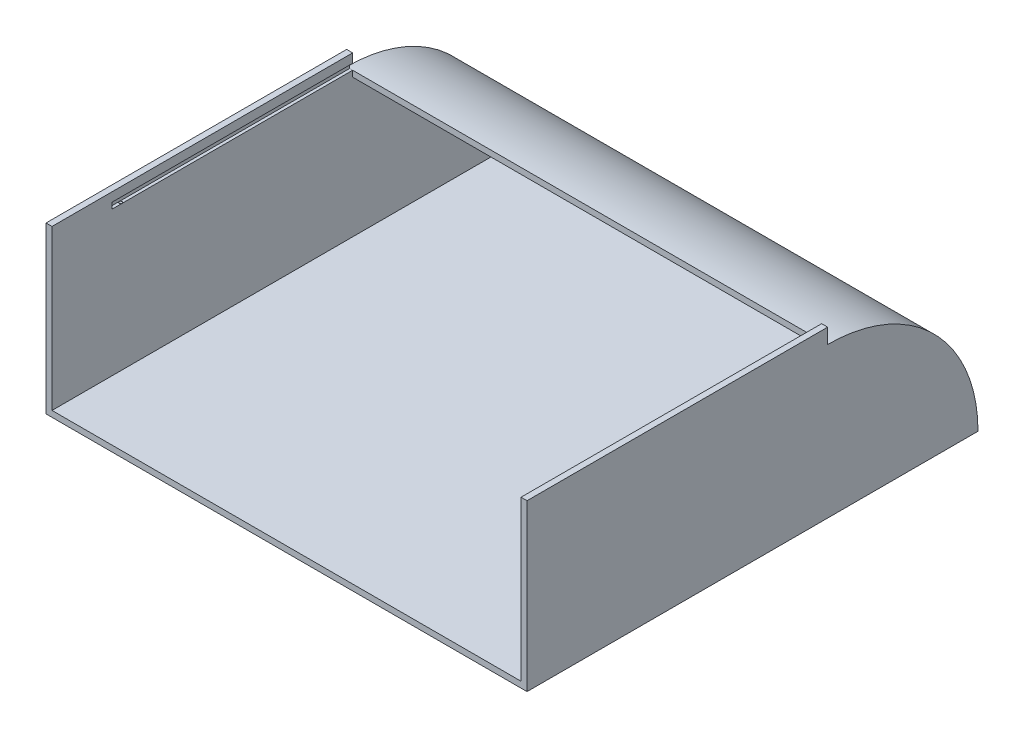
from build123d import *

# Parameters (mm, degrees)
SKETCH1_W           = 150
SKETCH1_H           = 50
BOSS_EXTRUDE1_DEPTH = 160
FILLET2_R           = 50
SHELL1_T            = -2
CUT_EXTRUDE1_DEPTH  = 2
SKETCH20_W          = 2
SKETCH20_H          = 100
BOSS_EXTRUDE2_DEPTH = 5
SKETCH21_W          = 80
SKETCH21_H          = 2
CUT_EXTRUDE2_DEPTH  = 1
SKETCH22_W          = 80
SKETCH22_H          = 2
CUT_EXTRUDE3_DEPTH  = 1


with BuildPart() as part:
    # Sketch1 → Boss-Extrude1 (new body)
    with BuildSketch(Plane(origin=(0, 0, 0), x_dir=(0, 0, -1), z_dir=(1, 0, 0))):
        Rectangle(SKETCH1_W, SKETCH1_H)
    extrude(amount=-BOSS_EXTRUDE1_DEPTH)

    # Fillet2
    fillet2_edges = [part.edges().sort_by_distance(p)[0] for p in [
        (-80, 25, -75),
    ]]
    fillet(fillet2_edges, radius=FILLET2_R - 0.0001)  # a hair under: the kernel refuses the full size

    # Shell1
    shell1_openings = [part.faces().sort_by_distance(p)[0] for p in [
        (-80, 0, 75),
    ]]
    offset(amount=SHELL1_T, openings=shell1_openings, kind=Kind.INTERSECTION)

    # Sketch17 → Cut-Extrude1 (cut)
    with BuildSketch(Plane(origin=(0, 25, 0), x_dir=(1, 0, 0), z_dir=(0, 1, 0))):
        Polygon((-80, 25), (-158, 25), (-158, -75), (-2, -75), (-2, 25), align=None)
    extrude(amount=-CUT_EXTRUDE1_DEPTH, mode=Mode.SUBTRACT)

    # Sketch20 → Boss-Extrude2 (add)
    with BuildSketch(Plane(origin=(0, 25, 0), x_dir=(1, 0, 0), z_dir=(0, 1, 0))):
        with Locations((-159, -25)):
            Rectangle(SKETCH20_W, SKETCH20_H)
        with Locations((-1, -25)):
            Rectangle(SKETCH20_W, SKETCH20_H)
    extrude(amount=BOSS_EXTRUDE2_DEPTH)

    # Sketch21 → Cut-Extrude2 (cut)
    with BuildSketch(Plane(origin=(-158, 0, 0), x_dir=(0, 0, -1), z_dir=(1, 0, 0))):
        with Locations((-15, 26)):
            Rectangle(SKETCH21_W, SKETCH21_H)
    extrude(amount=-CUT_EXTRUDE2_DEPTH, mode=Mode.SUBTRACT)

    # Sketch22 → Cut-Extrude3 (cut)
    with BuildSketch(Plane.ZY.offset(2)):
        with Locations((15, 26)):
            Rectangle(SKETCH22_W, SKETCH22_H)
    extrude(amount=-CUT_EXTRUDE3_DEPTH, mode=Mode.SUBTRACT)

    # Sketch25 → Cut-Revolve1 (revolve, cut)
    with BuildSketch(Plane(origin=(0, 25, 0), x_dir=(1, 0, 0), z_dir=(0, 1, 0))):
        with BuildLine():
            ThreePointArc((-1.475259699, -50.499387542), (-1.999387542, -50.024740301), (-1.524740301, -49.500612458))
            Line((-1.524740301, -49.500612458), (-1.5, -50))
            Line((-1.5, -50), (-1.475259699, -50.499387542))
        make_face()
    revolve(axis=Axis((-1.5, 25, 50), (-0.049480602249094376, 0, -0.9987750847919)), mode=Mode.SUBTRACT)

    # Sketch26 → Cut-Revolve2 (revolve, cut)
    with BuildSketch(Plane(origin=(0, 25, 0), x_dir=(1, 0, 0), z_dir=(0, 1, 0))):
        with BuildLine():
            Line((-158, -51.676352911), (-159, -51.676352911))
            ThreePointArc((-159, -51.676352911), (-158.5, -52.176352911), (-158, -51.676352911))
        make_face()
    revolve(axis=Axis((-158, 25, 51.676352911), (-1, 0, 0)), mode=Mode.SUBTRACT)


solid = part.part
